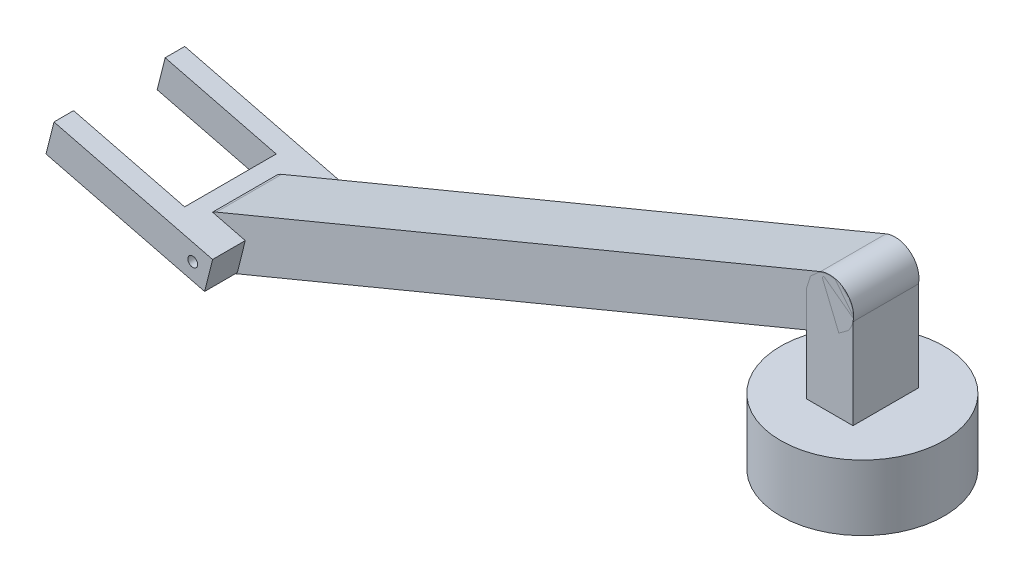
from build123d import *

# Parameters (mm, degrees)
SKETCH_2_R          = 25
EXTRUDE_1_DEPTH     = 20
EXTRUDE_2_DEPTH     = 10
EXTRUDE_3_DEPTH     = 10
SKETCH_6_R          = 1.5
EXTRUDE_4_DEPTH     = 30
SKETCH_7_W          = 35
SKETCH_7_H          = 28
SKETCH_7_W_2        = 82.955010688
SKETCH_7_H_2        = 10
CUT_EXTRUDE_1_DEPTH = 248.16093671


with BuildPart() as part:
    # 草圖2 → 填料-伸長1 (new body)
    with BuildSketch(Plane(origin=(0, 0, 0), x_dir=(1, 0, 0), z_dir=(0, 1, 0))):
        Circle(SKETCH_2_R)
    extrude(amount=EXTRUDE_1_DEPTH)

    # 草圖4 → 填料-伸長2 (add, symmetric)
    with BuildSketch(Plane.XY):
        with BuildLine():
            Line((-7.125648149, 20), (-7.125648149, 49.101375051))
            ThreePointArc((-7.125648149, 49.101375051), (0, 56.227023201), (7.125648149, 49.101375051))
            Line((7.125648149, 49.101375051), (7.125648149, 20))
            ThreePointArc((7.125648149, 20), (0, 12.874351851), (-7.125648149, 20))
        make_face()
    extrude(amount=EXTRUDE_2_DEPTH, both=True)


with BuildPart() as body_2:
    # 草圖5 → 填料-伸長3 (new, symmetric)
    with BuildSketch(Plane.XY):
        with BuildLine():
            Line((2.797199891, 42.356410459), (-181.946306774, -34.25844936))
            ThreePointArc((-181.946306774, -34.25844936), (-191.488471258, -30.310684658), (-187.540706557, -20.768520175))
            Line((-187.540706557, -20.768520175), (-2.797199891, 55.846339644))
            ThreePointArc((-2.797199891, 55.846339644), (6.744964593, 51.898574942), (2.797199891, 42.356410459))
        make_face()
    extrude(amount=EXTRUDE_3_DEPTH, both=True)

    # 草圖6 → 填料-伸長4 (add, symmetric)
    with BuildSketch(Plane.XY):
        Polygon((-181.109627774, -33.579366748), (-178.677624685, -23.879605876), (-227.176429045, -11.71959043), (-229.608432134, -21.419351302), align=None)
        with Locations((-184.743506665, -27.513484767)):
            Circle(SKETCH_6_R, mode=Mode.SUBTRACT)
    extrude(amount=EXTRUDE_4_DEPTH, both=True)

    # 草圖7 → 除料-伸長1 (cut, through all)
    with BuildSketch(Plane(origin=(-16.201299347, -64.616994186, 0), x_dir=(0.9699760871989805, -0.24320030892693367, 0), z_dir=(0.24320030892693367, 0.9699760871989805, 0))):
        with Locations((-200.005495736, 0)):
            Rectangle(SKETCH_7_W, SKETCH_7_H)
        with Locations((-176.027990392, 25)):
            Rectangle(SKETCH_7_W_2, SKETCH_7_H_2)
        with Locations((-176.027990392, -25)):
            Rectangle(SKETCH_7_W_2, SKETCH_7_H_2)
    extrude(amount=-CUT_EXTRUDE_1_DEPTH, mode=Mode.SUBTRACT)


solid = Compound([part.part, body_2.part])
